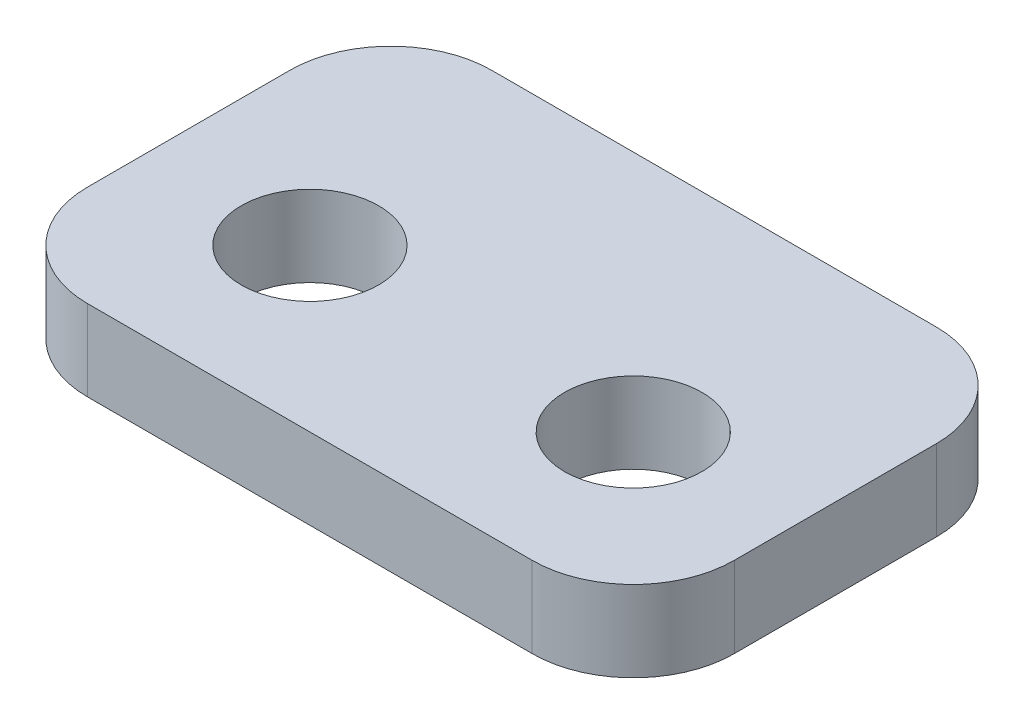
from build123d import *

# Parameters (mm, degrees)
SKETCH1_W           = 16
SKETCH1_H           = 10
SKETCH1_R           = 1.7
BOSS_EXTRUDE1_DEPTH = 2
FILLET1_R           = 2.5


with BuildPart() as part:
    # Sketch1 → Boss-Extrude1 (new body)
    with BuildSketch(Plane(origin=(0, 0, 0), x_dir=(1, 0, 0), z_dir=(0, 1, 0))):
        with Locations((0, 1)):
            Rectangle(SKETCH1_W, SKETCH1_H)
        with Locations((-4, 0)):
            Circle(SKETCH1_R, mode=Mode.SUBTRACT)
        with Locations((4, 0)):
            Circle(SKETCH1_R, mode=Mode.SUBTRACT)
    extrude(amount=BOSS_EXTRUDE1_DEPTH)

    # Fillet1
    fillet1_edges = [part.edges().sort_by_distance(p)[0] for p in [
        (-8, 1, 4),
        (-8, 1, -6),
        (8, 1, -6),
        (8, 1, 4),
    ]]
    fillet(fillet1_edges, radius=FILLET1_R)


solid = part.part
